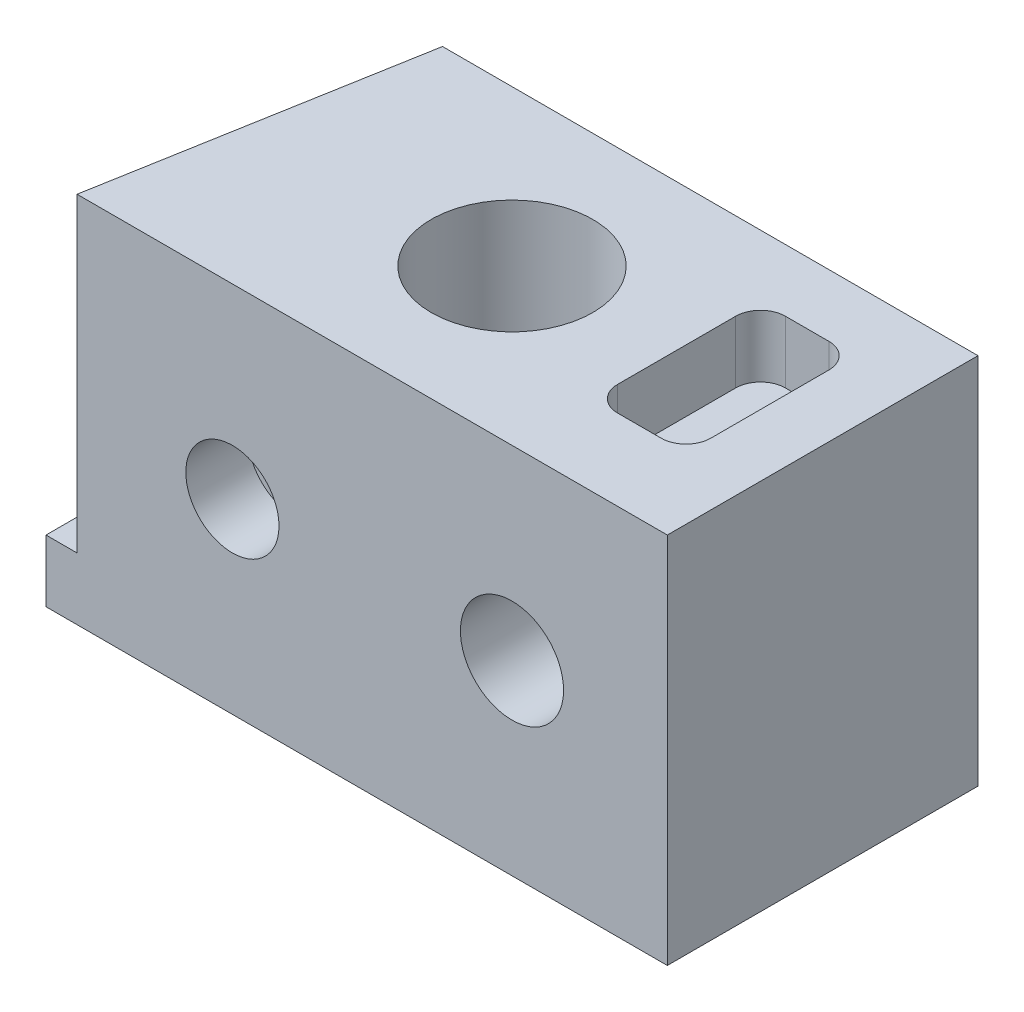
from build123d import *

# Parameters (mm, degrees)
SKETCH1_W           = 100
SKETCH1_H           = 50
BOSS_EXTRUDE1_DEPTH = 60
CUT_EXTRUDE1_DEPTH  = 50
SKETCH3_R           = 13
CUT_EXTRUDE2_DEPTH  = 50
SKETCH4_R           = 8.30196488
CUT_EXTRUDE3_DEPTH  = 93.736184955
CUT_EXTRUDE4_DEPTH  = 10
SKETCH7_R           = 7.5
CUT_EXTRUDE5_DEPTH  = 10


with BuildPart() as part:
    # Sketch1 → Boss-Extrude1 (new body)
    with BuildSketch(Plane(origin=(0, 0, 0), x_dir=(1, 0, 0), z_dir=(0, 1, 0))):
        Rectangle(SKETCH1_W, SKETCH1_H)
    extrude(amount=BOSS_EXTRUDE1_DEPTH)

    # Sketch2 → Cut-Extrude1 (cut)
    with BuildSketch(Plane(origin=(0, 60, 0), x_dir=(1, 0, 0), z_dir=(0, 1, 0))):
        Polygon((-50, 25), (-36.183650965, 25), (-45, -25), (-50, -25), align=None)
    extrude(amount=-CUT_EXTRUDE1_DEPTH, mode=Mode.SUBTRACT)

    # Sketch3 → Cut-Extrude2 (cut)
    with BuildSketch(Plane(origin=(0, 60, 0), x_dir=(1, 0, 0), z_dir=(0, 1, 0))):
        Circle(SKETCH3_R)
    extrude(amount=-CUT_EXTRUDE2_DEPTH, mode=Mode.SUBTRACT)

    # Sketch4 → Cut-Extrude3 (cut, through all)
    with BuildSketch(Plane.XY.offset(25)):
        with Locations((25, 30)):
            Circle(SKETCH4_R)
    extrude(amount=-CUT_EXTRUDE3_DEPTH, mode=Mode.SUBTRACT)

    # Sketch6 → Cut-Extrude4 (cut)
    with BuildSketch(Plane(origin=(0, 60, 0), x_dir=(1, 0, 0), z_dir=(0, 1, 0))):
        with BuildLine():
            Line((29, 15), (36, 15))
            ThreePointArc((36, 15), (38.828427125, 13.828427125), (40, 11))
            Line((40, 11), (40, -8))
            ThreePointArc((40, -8), (38.828427125, -10.828427125), (36, -12))
            Line((36, -12), (29, -12))
            ThreePointArc((29, -12), (26.171572875, -10.828427125), (25, -8))
            Line((25, -8), (25, 11))
            ThreePointArc((25, 11), (26.171572875, 13.828427125), (29, 15))
        make_face()
    extrude(amount=-CUT_EXTRUDE4_DEPTH, mode=Mode.SUBTRACT)

    # Sketch7 → Cut-Extrude5 (cut)
    with BuildSketch(Plane.XY.offset(25)):
        with Locations((-20, 30)):
            Circle(SKETCH7_R)
    extrude(amount=-CUT_EXTRUDE5_DEPTH, mode=Mode.SUBTRACT)


solid = part.part
